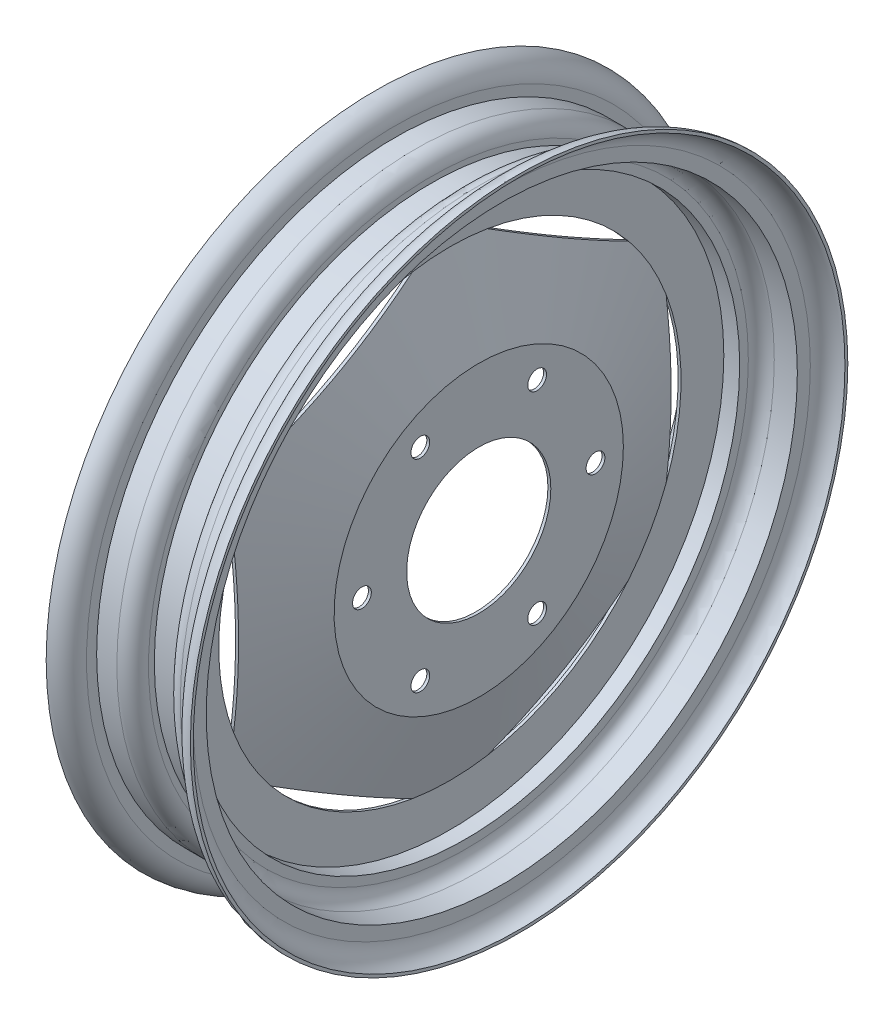
from build123d import *

# Parameters (mm, degrees)
CUT_EXTRUDE1_DEPTH = 331.381597619
SKETCH3_R          = 6.505
CUT_EXTRUDE2_DEPTH = 22
CIRPATTERN1_COUNT  = 6


# Read off the part's stored shape, not the designer's step: Thicken1, Thicken2
with BuildPart() as part:
    # Thicken1 outline → Thicken1 (revolve)
    with BuildSketch(Plane.YX):
        Polygon((50, 22), (50, 20), (100, 20), (160, 0), (190, 0), (190, 2), (160.32455532, 2), (100.32455532, 22), align=None)
    revolve(axis=Axis((0, 0, 0), (1, 0, 0)))

    # Thicken2 outline → Thicken2 (revolve)
    with BuildSketch(Plane.YX):
        with BuildLine():
            Line((190, -13), (196, -13))
            ThreePointArc((196, -13), (202.363961031, -15.636038969), (205, -22))
            Line((205, -22), (205, -38))
            Line((205, -38), (214, -38))
            ThreePointArc((214, -38), (222.485281374, -41.514718626), (226, -50))
            Line((226, -50), (228, -50))
            ThreePointArc((228, -50), (223.899494937, -40.100505063), (214, -36))
            Line((214, -36), (207, -36))
            Line((207, -36), (207, -22))
            ThreePointArc((207, -22), (203.778174593, -14.221825407), (196, -11))
            Line((196, -11), (192, -11))
            Line((192, -11), (192, 11))
            Line((192, 11), (196, 11))
            ThreePointArc((196, 11), (203.778174593, 14.221825407), (207, 22))
            Line((207, 22), (207, 36))
            Line((207, 36), (214, 36))
            ThreePointArc((214, 36), (223.899494937, 40.100505063), (228, 50))
            Line((228, 50), (226, 50))
            ThreePointArc((226, 50), (222.485281374, 41.514718626), (214, 38))
            Line((214, 38), (205, 38))
            Line((205, 38), (205, 22))
            ThreePointArc((205, 22), (202.363961031, 15.636038969), (196, 13))
            Line((196, 13), (190, 13))
            Line((190, 13), (190, -13))
        make_face()
    revolve(axis=Axis((0, 0, 0), (1, 0, 0)))

    # Sketch2 → Cut-Extrude1 (cut, through all)
    with BuildSketch(Plane(origin=(22, 0, 0), x_dir=(0, 0, -1), z_dir=(1, 0, 0))):
        with BuildLine():
            Line((-150, 56.6035603), (-150, -56.6035603))
            ThreePointArc((-150, -56.6035603), (-160.32455532, 0), (-150, 56.6035603))
        make_face()
    cut_extrude1 = extrude(amount=-CUT_EXTRUDE1_DEPTH, mode=Mode.SUBTRACT)

    # Sketch3 → Cut-Extrude2 (cut)
    with BuildSketch(Plane(origin=(22, 0, 0), x_dir=(0, 0, -1), z_dir=(1, 0, 0))):
        with Locations((-81, 0)):
            Circle(SKETCH3_R)
    cut_extrude2 = extrude(amount=-CUT_EXTRUDE2_DEPTH, mode=Mode.SUBTRACT)

    # CirPattern1: Cut-Extrude1, Cut-Extrude2 ×6 about axis
    cirpattern1_axis = Axis((0, 0, 0), (1, 0, 0))
    add([cut_extrude1.rotate(cirpattern1_axis, i * 360 / CIRPATTERN1_COUNT) for i in range(1, CIRPATTERN1_COUNT)], mode=Mode.SUBTRACT)
    add([cut_extrude2.rotate(cirpattern1_axis, i * 360 / CIRPATTERN1_COUNT) for i in range(1, CIRPATTERN1_COUNT)], mode=Mode.SUBTRACT)


solid = part.part
